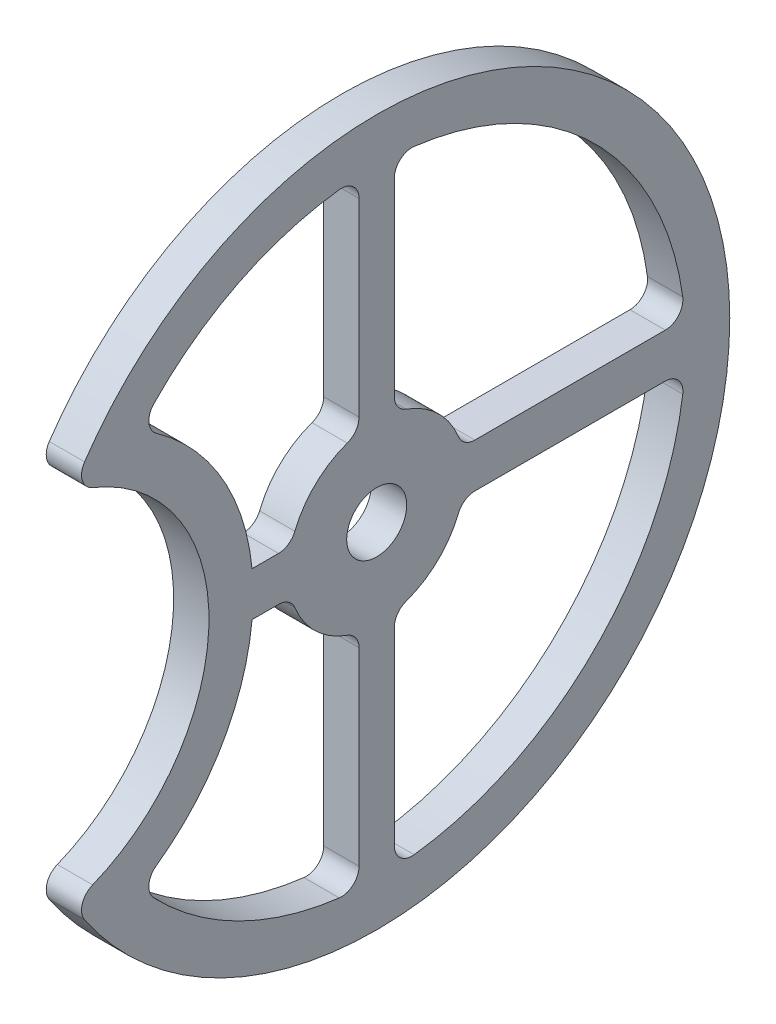
from build123d import *

# Parameters (mm, degrees)
SKETCH1_R           = 1.6
BOSS_EXTRUDE1_DEPTH = 4
FILLET1_R           = 2
SKETCH2_R           = 3.4
CUT_EXTRUDE1_DEPTH  = 57.709787663


with BuildPart() as part:
    # Sketch1 → Boss-Extrude1 (new body)
    with BuildSketch(Plane(origin=(0, 0, 0), x_dir=(0, 0, -1), z_dir=(1, 0, 0))):
        with BuildLine():
            ThreePointArc((-34.4875, 20.263571841), (-19, 0), (-34.4875, -20.263571841))
            ThreePointArc((-34.4875, -20.263571841), (40, 0), (-34.4875, 20.263571841))
        make_face()
        with BuildLine():
            ThreePointArc((-26.8625, 22.436713078), (-15.727733284, 31.267209753), (-2, 34.942810419))
            Line((-2, 34.942810419), (-2, 9.797958971))
            ThreePointArc((-2, 9.797958971), (-6.887307867, 7.250171746), (-9.682458366, 2.5))
            Line((-9.682458366, 2.5), (-14.120471411, 2.5))
            ThreePointArc((-14.120471411, 2.5), (-18.092232837, 14.001776242), (-26.8625, 22.436713078))
        make_face(mode=Mode.SUBTRACT)
        with BuildLine():
            ThreePointArc((-26.8625, -22.436713078), (-18.092232837, -14.001776242), (-14.120471411, -2.5))
            Line((-14.120471411, -2.5), (-9.682458366, -2.5))
            ThreePointArc((-9.682458366, -2.5), (-6.887307867, -7.250171746), (-2, -9.797958971))
            Line((-2, -9.797958971), (-2, -34.942810419))
            ThreePointArc((-2, -34.942810419), (-15.727733284, -31.267209753), (-26.8625, -22.436713078))
        make_face(mode=Mode.SUBTRACT)
        with BuildLine():
            Line((2, -34.942810419), (2, -9.797958971))
            ThreePointArc((2, -9.797958971), (6.887307867, -7.250171746), (9.682458366, -2.5))
            Line((9.682458366, -2.5), (34.910600109, -2.5))
            ThreePointArc((34.910600109, -2.5), (24.570960239, -24.925246497), (2, -34.942810419))
        make_face(mode=Mode.SUBTRACT)
        with BuildLine():
            ThreePointArc((2, 34.942810419), (24.570960239, 24.925246497), (34.910600109, 2.5))
            Line((34.910600109, 2.5), (9.682458366, 2.5))
            ThreePointArc((9.682458366, 2.5), (6.887307867, 7.250171746), (2, 9.797958971))
            Line((2, 9.797958971), (2, 34.942810419))
        make_face(mode=Mode.SUBTRACT)
        Circle(SKETCH1_R, mode=Mode.SUBTRACT)
    extrude(amount=BOSS_EXTRUDE1_DEPTH)

    # Fillet1
    fillet1_edges = [part.edges().sort_by_distance(p)[0] for p in [
        (2, 2.5, 9.682458366),
        (2, -2.5, 9.682458366),
        (2, -9.797958971, 2),
        (2, -34.942810419, -2),
        (2, -34.942810419, 2),
        (2, -22.436713078, 26.8625),
        (2, 22.436713078, 26.8625),
        (2, 9.797958971, 2),
        (2, 9.797958971, -2),
        (2, 2.5, -9.682458366),
        (2, -2.5, -9.682458366),
        (2, -9.797958971, -2),
        (2, -2.5, -34.910600109),
        (2, 2.5, -34.910600109),
        (2, 34.942810419, -2),
        (2, 34.942810419, 2),
        (2, 20.263571841, 34.4875),
        (2, -20.263571841, 34.4875),
    ]]
    fillet(fillet1_edges, radius=FILLET1_R)

    # Sketch2 → Cut-Extrude1 (cut, through all)
    with BuildSketch(Plane.ZY):
        Circle(SKETCH2_R)
    extrude(amount=-CUT_EXTRUDE1_DEPTH, mode=Mode.SUBTRACT)


solid = part.part
